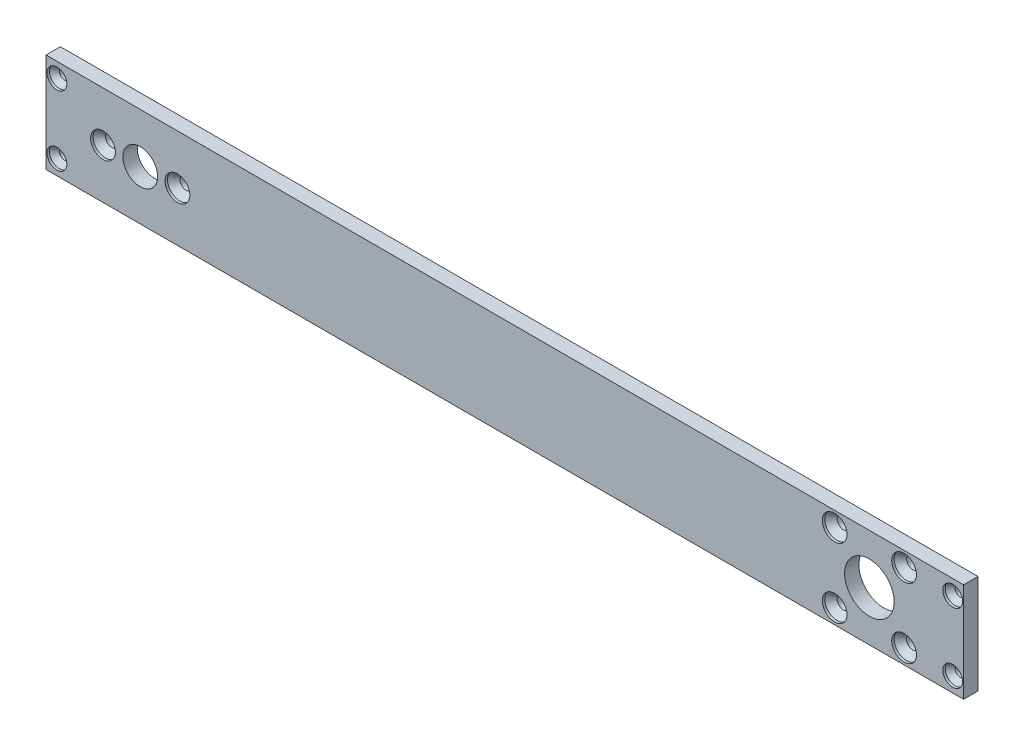
from build123d import *

# Parameters (mm, degrees)
SKETCH1_W                                      = 185
SKETCH1_H                                      = 20
BASE_SHAPE_DEPTH                               = 2.9
MOTOR_CUTOUTS_REACH                            = 95.084
SKETCH2_R                                      = 1.25
SKETCH2_R_2                                    = 3.5
SKETCH2_R_3                                    = 5
MOTOR_M2_5_COUNTERSUNKS_AT_2_COUNT             = 2
MOTOR_M2_5_COUNTERSUNKS_AT_2_PITCH             = 15
MOTOR_M2_5_COUNTERSUNKS_AT_3_COUNT             = 2
MOTOR_M2_5_COUNTERSUNKS_AT_3_PITCH             = 147.666008275
MOTOR_M2_5_COUNTERSUNKS_AT_4_COUNT             = 2
MOTOR_M2_5_COUNTERSUNKS_AT_4_PITCH             = 161.651631603
MOTOR_M2_5_COUNTERSUNKS_AT_5_COUNT             = 2
MOTOR_M2_5_COUNTERSUNKS_AT_5_PITCH             = 147.666008275
MOTOR_M2_5_COUNTERSUNKS_AT_6_COUNT             = 2
MOTOR_M2_5_COUNTERSUNKS_AT_6_PITCH             = 161.651631603
PCB_SLOT_DEPTH                                 = 0.775
END_PLATE_HOLES_REACH                          = 95.084
SKETCH6_R                                      = 1
CSK_FOR_M2_FLAT_HEAD_MACHINE_SCREW3_AT_2_COUNT = 2
CSK_FOR_M2_FLAT_HEAD_MACHINE_SCREW3_AT_2_PITCH = 14
CSK_FOR_M2_FLAT_HEAD_MACHINE_SCREW3_AT_3_COUNT = 2
CSK_FOR_M2_FLAT_HEAD_MACHINE_SCREW3_AT_3_PITCH = 180.6
CSK_FOR_M2_FLAT_HEAD_MACHINE_SCREW3_AT_4_COUNT = 2
CSK_FOR_M2_FLAT_HEAD_MACHINE_SCREW3_AT_4_PITCH = 181.14182289


with BuildPart() as part:
    # Sketch1 → Base shape (new body)
    with BuildSketch(Plane.XY):
        Rectangle(SKETCH1_W, SKETCH1_H)
    extrude(amount=-BASE_SHAPE_DEPTH)

    # Sketch2 → Motor cutouts (cut, up to next)
    with BuildSketch(Plane.XY, mode=Mode.PRIVATE) as motor_cutouts_sk1:
        with Locations((-81, 0)):
            Circle(SKETCH2_R)
    motor_cutouts_tool1 = extrude(motor_cutouts_sk1.sketch, amount=-MOTOR_CUTOUTS_REACH, mode=Mode.PRIVATE) & part.part
    # Sketch2 → Motor cutouts (cut, up to next)
    with BuildSketch(Plane.XY, mode=Mode.PRIVATE) as motor_cutouts_sk2:
        with Locations((-66, 0)):
            Circle(SKETCH2_R)
    motor_cutouts_tool2 = extrude(motor_cutouts_sk2.sketch, amount=-MOTOR_CUTOUTS_REACH, mode=Mode.PRIVATE) & part.part
    # Sketch2 → Motor cutouts (cut, up to next)
    with BuildSketch(Plane.XY, mode=Mode.PRIVATE) as motor_cutouts_sk3:
        with Locations((-73.5, 0)):
            Circle(SKETCH2_R_2)
    motor_cutouts_tool3 = extrude(motor_cutouts_sk3.sketch, amount=-MOTOR_CUTOUTS_REACH, mode=Mode.PRIVATE) & part.part
    # Sketch2 → Motor cutouts (cut, up to next)
    with BuildSketch(Plane.XY, mode=Mode.PRIVATE) as motor_cutouts_sk4:
        with Locations((73.5, 0)):
            Circle(SKETCH2_R_3)
    motor_cutouts_tool4 = extrude(motor_cutouts_sk4.sketch, amount=-MOTOR_CUTOUTS_REACH, mode=Mode.PRIVATE) & part.part
    # Sketch2 → Motor cutouts (cut, up to next)
    with BuildSketch(Plane.XY, mode=Mode.PRIVATE) as motor_cutouts_sk5:
        with Locations((66.5, 7)):
            Circle(SKETCH2_R)
    motor_cutouts_tool5 = extrude(motor_cutouts_sk5.sketch, amount=-MOTOR_CUTOUTS_REACH, mode=Mode.PRIVATE) & part.part
    # Sketch2 → Motor cutouts (cut, up to next)
    with BuildSketch(Plane.XY, mode=Mode.PRIVATE) as motor_cutouts_sk6:
        with Locations((80.5, 7)):
            Circle(SKETCH2_R)
    motor_cutouts_tool6 = extrude(motor_cutouts_sk6.sketch, amount=-MOTOR_CUTOUTS_REACH, mode=Mode.PRIVATE) & part.part
    # Sketch2 → Motor cutouts (cut, up to next)
    with BuildSketch(Plane.XY, mode=Mode.PRIVATE) as motor_cutouts_sk7:
        with Locations((80.5, -7)):
            Circle(SKETCH2_R)
    motor_cutouts_tool7 = extrude(motor_cutouts_sk7.sketch, amount=-MOTOR_CUTOUTS_REACH, mode=Mode.PRIVATE) & part.part
    # Sketch2 → Motor cutouts (cut, up to next)
    with BuildSketch(Plane.XY, mode=Mode.PRIVATE) as motor_cutouts_sk8:
        with Locations((66.5, -7)):
            Circle(SKETCH2_R)
    motor_cutouts_tool8 = extrude(motor_cutouts_sk8.sketch, amount=-MOTOR_CUTOUTS_REACH, mode=Mode.PRIVATE) & part.part
    add(motor_cutouts_tool1.solids().sort_by_distance((-81, 0, 0))[0], mode=Mode.SUBTRACT)
    add(motor_cutouts_tool2.solids().sort_by_distance((-66, 0, 0))[0], mode=Mode.SUBTRACT)
    add(motor_cutouts_tool3.solids().sort_by_distance((-73.5, 0, 0))[0], mode=Mode.SUBTRACT)
    add(motor_cutouts_tool4.solids().sort_by_distance((73.5, 0, 0))[0], mode=Mode.SUBTRACT)
    add(motor_cutouts_tool5.solids().sort_by_distance((66.5, 7, 0))[0], mode=Mode.SUBTRACT)
    add(motor_cutouts_tool6.solids().sort_by_distance((80.5, 7, 0))[0], mode=Mode.SUBTRACT)
    add(motor_cutouts_tool7.solids().sort_by_distance((80.5, -7, 0))[0], mode=Mode.SUBTRACT)
    add(motor_cutouts_tool8.solids().sort_by_distance((66.5, -7, 0))[0], mode=Mode.SUBTRACT)

    # Sketch4 → Motor M2.5 countersunks (revolve, cut)
    with BuildSketch(Plane(origin=(-81, 0, 0), x_dir=(0, -1, 0), z_dir=(1, 0, 0))):
        Polygon((0, 0), (0, 2.9), (1.25, 2.9), (1.25, 1.75), (2.5, 0.5), (2.5, 0), align=None)
    motor_m2_5_countersunks = revolve(axis=Axis((-81, 0, 6.35), (0, 0, -1)), mode=Mode.SUBTRACT)

    # Motor M2.5 countersunks at 2: Motor M2.5 countersunks ×2
    with Locations(*[(i * MOTOR_M2_5_COUNTERSUNKS_AT_2_PITCH, 0, 0) for i in range(1, MOTOR_M2_5_COUNTERSUNKS_AT_2_COUNT)]):
        add(motor_m2_5_countersunks, mode=Mode.SUBTRACT)

    # Motor M2.5 countersunks at 3: Motor M2.5 countersunks ×2
    with Locations(*[Vector(0.9988757854473691, 0.047404274563603965, 0) * (i * MOTOR_M2_5_COUNTERSUNKS_AT_3_PITCH) for i in range(1, MOTOR_M2_5_COUNTERSUNKS_AT_3_COUNT)]):
        add(motor_m2_5_countersunks, mode=Mode.SUBTRACT)

    # Motor M2.5 countersunks at 4: Motor M2.5 countersunks ×2
    with Locations(*[Vector(0.9990619853213468, 0.043302996267798335, 0) * (i * MOTOR_M2_5_COUNTERSUNKS_AT_4_PITCH) for i in range(1, MOTOR_M2_5_COUNTERSUNKS_AT_4_COUNT)]):
        add(motor_m2_5_countersunks, mode=Mode.SUBTRACT)

    # Motor M2.5 countersunks at 5: Motor M2.5 countersunks ×2
    with Locations(*[Vector(0.9988757854473691, -0.04740427456360395, 0) * (i * MOTOR_M2_5_COUNTERSUNKS_AT_5_PITCH) for i in range(1, MOTOR_M2_5_COUNTERSUNKS_AT_5_COUNT)]):
        add(motor_m2_5_countersunks, mode=Mode.SUBTRACT)

    # Motor M2.5 countersunks at 6: Motor M2.5 countersunks ×2
    with Locations(*[Vector(0.9990619853213468, -0.0433029962677983, 0) * (i * MOTOR_M2_5_COUNTERSUNKS_AT_6_PITCH) for i in range(1, MOTOR_M2_5_COUNTERSUNKS_AT_6_COUNT)]):
        add(motor_m2_5_countersunks, mode=Mode.SUBTRACT)

    # Sketch5 → PCB slot (cut)
    with BuildSketch(Plane(origin=(0, 0, -2.9), x_dir=(-1, 0, 0), z_dir=(0, 0, -1))):
        with BuildLine():
            Line((-60, -6), (60, -6))
            ThreePointArc((60, -6), (61, -7), (60, -8))
            Line((60, -8), (-60, -8))
            ThreePointArc((-60, -8), (-61, -7), (-60, -6))
        make_face()
    extrude(amount=-PCB_SLOT_DEPTH, mode=Mode.SUBTRACT)

    # Sketch6 → End plate holes (cut, up to next)
    with BuildSketch(Plane.XY, mode=Mode.PRIVATE) as end_plate_holes_sk1:
        with Locations((90.3, 7)):
            Circle(SKETCH6_R)
    end_plate_holes_tool1 = extrude(end_plate_holes_sk1.sketch, amount=-END_PLATE_HOLES_REACH, mode=Mode.PRIVATE) & part.part
    # Sketch6 → End plate holes (cut, up to next)
    with BuildSketch(Plane.XY, mode=Mode.PRIVATE) as end_plate_holes_sk2:
        with Locations((90.3, -7)):
            Circle(SKETCH6_R)
    end_plate_holes_tool2 = extrude(end_plate_holes_sk2.sketch, amount=-END_PLATE_HOLES_REACH, mode=Mode.PRIVATE) & part.part
    # Sketch6 → End plate holes (cut, up to next)
    with BuildSketch(Plane.XY, mode=Mode.PRIVATE) as end_plate_holes_sk3:
        with Locations((-90.3, -7)):
            Circle(SKETCH6_R)
    end_plate_holes_tool3 = extrude(end_plate_holes_sk3.sketch, amount=-END_PLATE_HOLES_REACH, mode=Mode.PRIVATE) & part.part
    # Sketch6 → End plate holes (cut, up to next)
    with BuildSketch(Plane.XY, mode=Mode.PRIVATE) as end_plate_holes_sk4:
        with Locations((-90.3, 7)):
            Circle(SKETCH6_R)
    end_plate_holes_tool4 = extrude(end_plate_holes_sk4.sketch, amount=-END_PLATE_HOLES_REACH, mode=Mode.PRIVATE) & part.part
    add(end_plate_holes_tool1.solids().sort_by_distance((90.3, 7, 0))[0], mode=Mode.SUBTRACT)
    add(end_plate_holes_tool2.solids().sort_by_distance((90.3, -7, 0))[0], mode=Mode.SUBTRACT)
    add(end_plate_holes_tool3.solids().sort_by_distance((-90.3, -7, 0))[0], mode=Mode.SUBTRACT)
    add(end_plate_holes_tool4.solids().sort_by_distance((-90.3, 7, 0))[0], mode=Mode.SUBTRACT)

    # Sketch9 → CSK for M2 Flat Head Machine Screw3 (revolve, cut)
    with BuildSketch(Plane(origin=(90.3, 7, 0), x_dir=(0, -1, 0), z_dir=(1, 0, 0))):
        Polygon((0, 0), (0, 2.9), (1, 2.9), (1, 1.5), (2, 0.5), (2, 0), align=None)
    csk_for_m2_flat_head_machine_screw3 = revolve(axis=Axis((90.3, 7, 6.35), (0, 0, -1)), mode=Mode.SUBTRACT)

    # CSK for M2 Flat Head Machine Screw3 at 2: CSK for M2 Flat Head Machine Screw3 ×2
    with Locations(*[(0, -i * CSK_FOR_M2_FLAT_HEAD_MACHINE_SCREW3_AT_2_PITCH, 0) for i in range(1, CSK_FOR_M2_FLAT_HEAD_MACHINE_SCREW3_AT_2_COUNT)]):
        add(csk_for_m2_flat_head_machine_screw3, mode=Mode.SUBTRACT)

    # CSK for M2 Flat Head Machine Screw3 at 3: CSK for M2 Flat Head Machine Screw3 ×2
    with Locations(*[(-i * CSK_FOR_M2_FLAT_HEAD_MACHINE_SCREW3_AT_3_PITCH, 0, 0) for i in range(1, CSK_FOR_M2_FLAT_HEAD_MACHINE_SCREW3_AT_3_COUNT)]):
        add(csk_for_m2_flat_head_machine_screw3, mode=Mode.SUBTRACT)

    # CSK for M2 Flat Head Machine Screw3 at 4: CSK for M2 Flat Head Machine Screw3 ×2
    with Locations(*[Vector(-0.9970088470923093, -0.07728750752653572, 0) * (i * CSK_FOR_M2_FLAT_HEAD_MACHINE_SCREW3_AT_4_PITCH) for i in range(1, CSK_FOR_M2_FLAT_HEAD_MACHINE_SCREW3_AT_4_COUNT)]):
        add(csk_for_m2_flat_head_machine_screw3, mode=Mode.SUBTRACT)


solid = part.part
